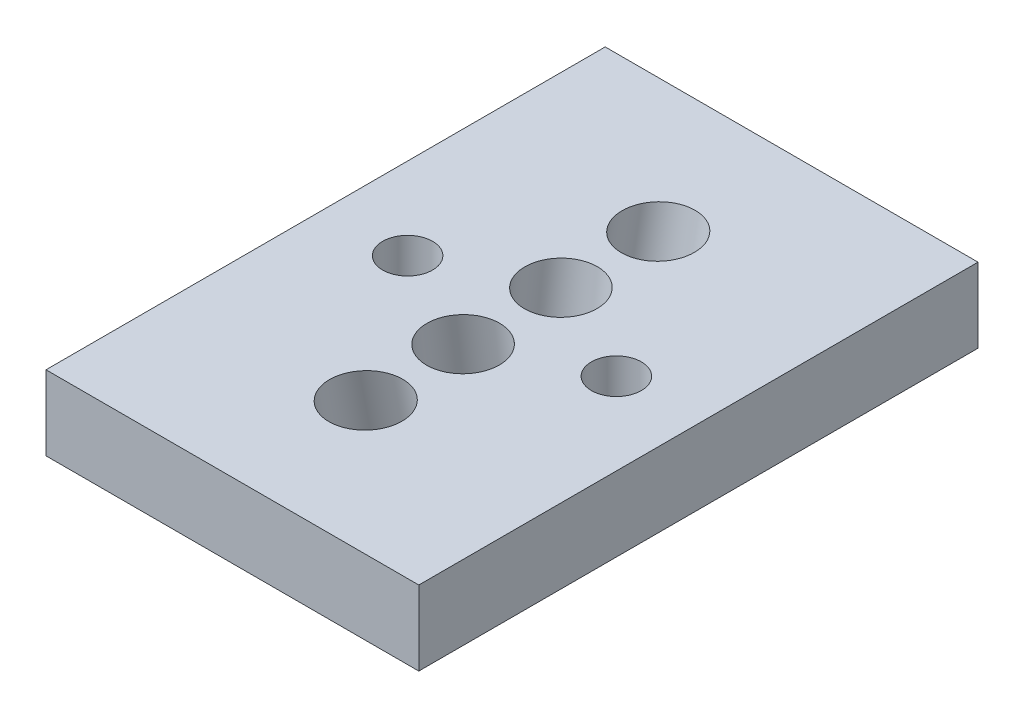
from build123d import *

# Parameters (mm, degrees)
SKETCH2_W                = 25.4
SKETCH2_H                = 38.1
BOSS_EXTRUDE1_DEPTH      = 5.08
SKETCH7_R                = 2.4638
CUT_EXTRUDE1_DEPTH       = 35.911486895
SKETCH16_R               = 2.4638
CUT_EXTRUDE2_DEPTH       = 42.261987287
M3_CLEARANCE_HOLE1_D     = 3.4
M3_CLEARANCE_HOLE1_DEPTH = 25.4
M3_CLEARANCE_HOLE1_TIP   = 1.021463052


with BuildPart() as part:
    # Sketch2 → Boss-Extrude1 (new body)
    with BuildSketch(Plane(origin=(0, 0, 0), x_dir=(1, 0, 0), z_dir=(0, 1, 0))):
        Rectangle(SKETCH2_W, SKETCH2_H)
    extrude(amount=BOSS_EXTRUDE1_DEPTH)

    # Sketch7 → Cut-Extrude1 (cut, symmetric)
    with BuildSketch(Plane(origin=(12.7, 5.08, 4.3561), x_dir=(-1, 0, 0), z_dir=(0, -0.992546151641323, -0.12186934340514102))):
        with Locations((12.7, 1.016)):
            Circle(SKETCH7_R)
    cut_extrude1 = extrude(amount=CUT_EXTRUDE1_DEPTH, both=True, mode=Mode.SUBTRACT)

    # Sketch16 → Cut-Extrude2 (cut, symmetric)
    with BuildSketch(Plane(origin=(12.7, 5.08, 13.0683), x_dir=(1, 0, 0), z_dir=(0, 0.9821090458140783, 0.18831309601342255))):
        with Locations((-12.7, 3.048)):
            Circle(SKETCH16_R)
    cut_extrude2 = extrude(amount=CUT_EXTRUDE2_DEPTH, both=True, mode=Mode.SUBTRACT)

    # Mirror2: Cut-Extrude1, Cut-Extrude2 across plane
    add(cut_extrude1.mirror(Plane(origin=(0, 0, 0), x_dir=(1, 0, 0), z_dir=(0, 0, -1))), mode=Mode.SUBTRACT)
    add(cut_extrude2.mirror(Plane(origin=(0, 0, 0), x_dir=(1, 0, 0), z_dir=(0, 0, -1))), mode=Mode.SUBTRACT)

    # M3 Clearance Hole1
    with Locations(Plane(origin=(0, 5.08, 0), x_dir=(1, 0, 0), z_dir=(0, 1, 0))):
        with Locations((7.112, 0), (-7.112, 0)):
            Hole(M3_CLEARANCE_HOLE1_D / 2, depth=M3_CLEARANCE_HOLE1_DEPTH)
            with Locations((0, 0, -(M3_CLEARANCE_HOLE1_DEPTH + M3_CLEARANCE_HOLE1_TIP / 2))):  # 118° drill point
                Cone(0, M3_CLEARANCE_HOLE1_D / 2, M3_CLEARANCE_HOLE1_TIP, mode=Mode.SUBTRACT)


solid = part.part
